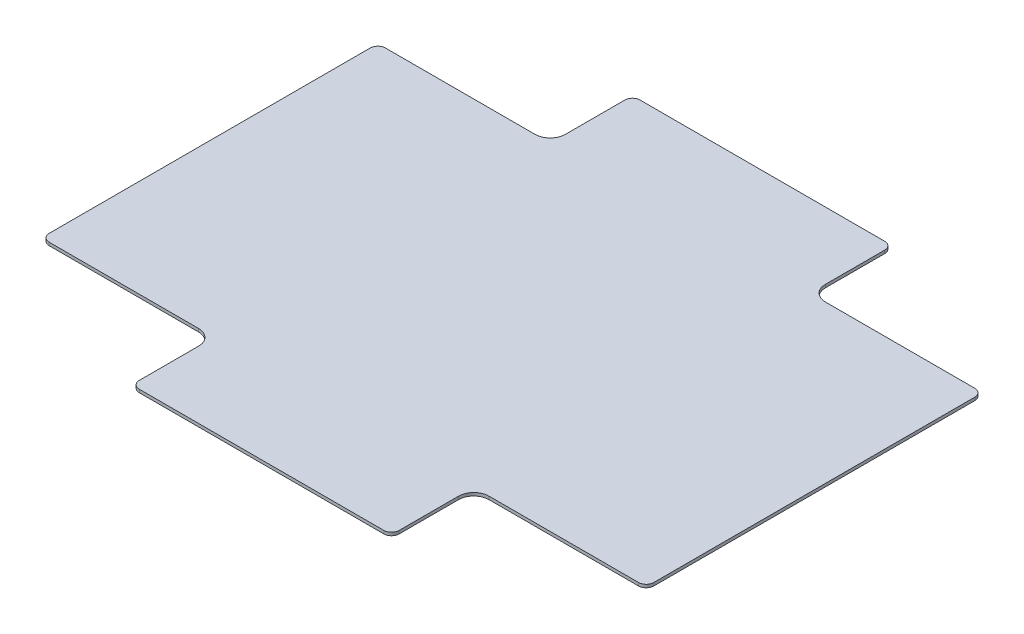
from build123d import *

# Parameters (mm, degrees)
EXTRUDE_1_DEPTH = 2


with BuildPart() as part:
    # Эскиз1 → Бобышка-Вытянуть1 (new body)
    with BuildSketch(Plane(origin=(0, 0, 0), x_dir=(1, 0, 0), z_dir=(0, 1, 0))):
        with BuildLine():
            ThreePointArc((-85, -158.805454142), (-83.535533906, -162.340988048), (-80, -163.805454142))
            Line((-80, -163.805454142), (80, -163.805454142))
            ThreePointArc((80, -163.805454142), (83.535533906, -162.340988048), (85, -158.805454142))
            Line((85, -158.805454142), (85, -120))
            ThreePointArc((85, -120), (87.928932188, -112.928932188), (95, -110))
            Line((95, -110), (192.768667216, -110))
            ThreePointArc((192.768667216, -110), (196.304201122, -108.535533906), (197.768667216, -105))
            Line((197.768667216, -105), (197.768667216, 105))
            ThreePointArc((197.768667216, 105), (196.304201122, 108.535533906), (192.768667216, 110))
            Line((192.768667216, 110), (95, 110))
            ThreePointArc((95, 110), (87.928932188, 112.928932188), (85, 120))
            Line((85, 120), (85, 158.805454142))
            ThreePointArc((85, 158.805454142), (83.535533906, 162.340988048), (80, 163.805454142))
            Line((80, 163.805454142), (-80, 163.805454142))
            ThreePointArc((-80, 163.805454142), (-83.535533906, 162.340988048), (-85, 158.805454142))
            Line((-85, 158.805454142), (-85, 120))
            ThreePointArc((-85, 120), (-87.928932188, 112.928932188), (-95, 110))
            Line((-95, 110), (-192.768667216, 110))
            ThreePointArc((-192.768667216, 110), (-196.304201122, 108.535533906), (-197.768667216, 105))
            Line((-197.768667216, 105), (-197.768667216, -105))
            ThreePointArc((-197.768667216, -105), (-196.304201122, -108.535533906), (-192.768667216, -110))
            Line((-192.768667216, -110), (-95, -110))
            ThreePointArc((-95, -110), (-87.928932188, -112.928932188), (-85, -120))
            Line((-85, -120), (-85, -158.805454142))
        make_face()
    extrude(amount=EXTRUDE_1_DEPTH)


solid = part.part
